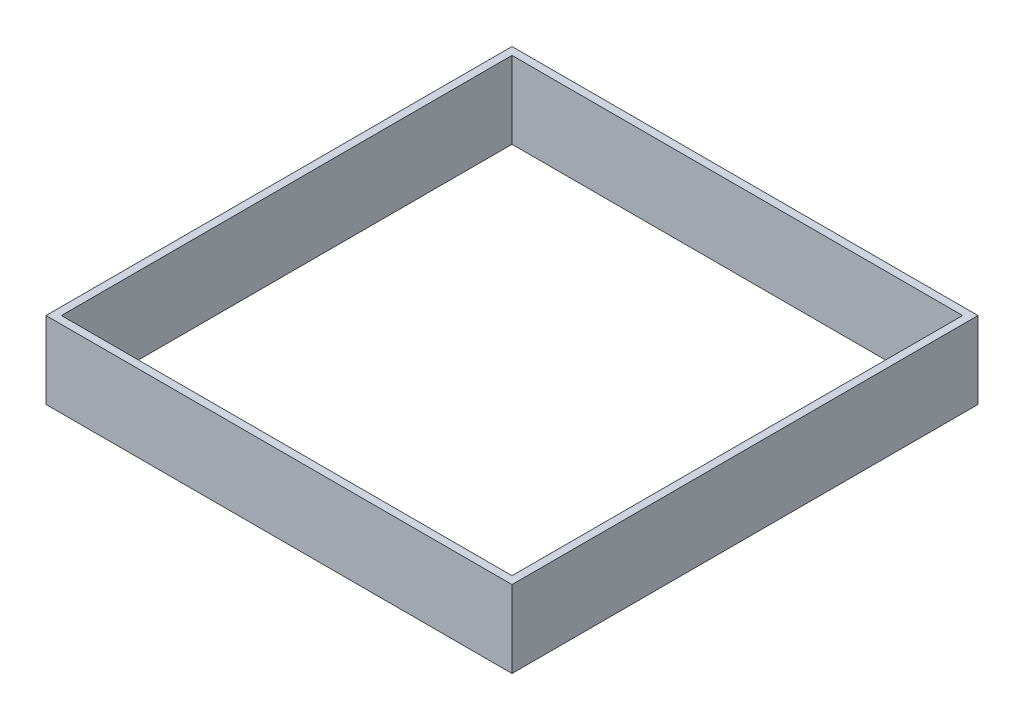
from build123d import *

# Parameters (mm, degrees)
SKETCH1_W           = 121
SKETCH1_H           = 121
SKETCH1_W_2         = 117
SKETCH1_H_2         = 117
BOSS_EXTRUDE1_DEPTH = 20


with BuildPart() as part:
    # Sketch1 → Boss-Extrude1 (new body)
    with BuildSketch(Plane(origin=(0, 0, 0), x_dir=(1, 0, 0), z_dir=(0, 1, 0))):
        Rectangle(SKETCH1_W, SKETCH1_H)
        Rectangle(SKETCH1_W_2, SKETCH1_H_2, mode=Mode.SUBTRACT)
    extrude(amount=BOSS_EXTRUDE1_DEPTH)


solid = part.part
